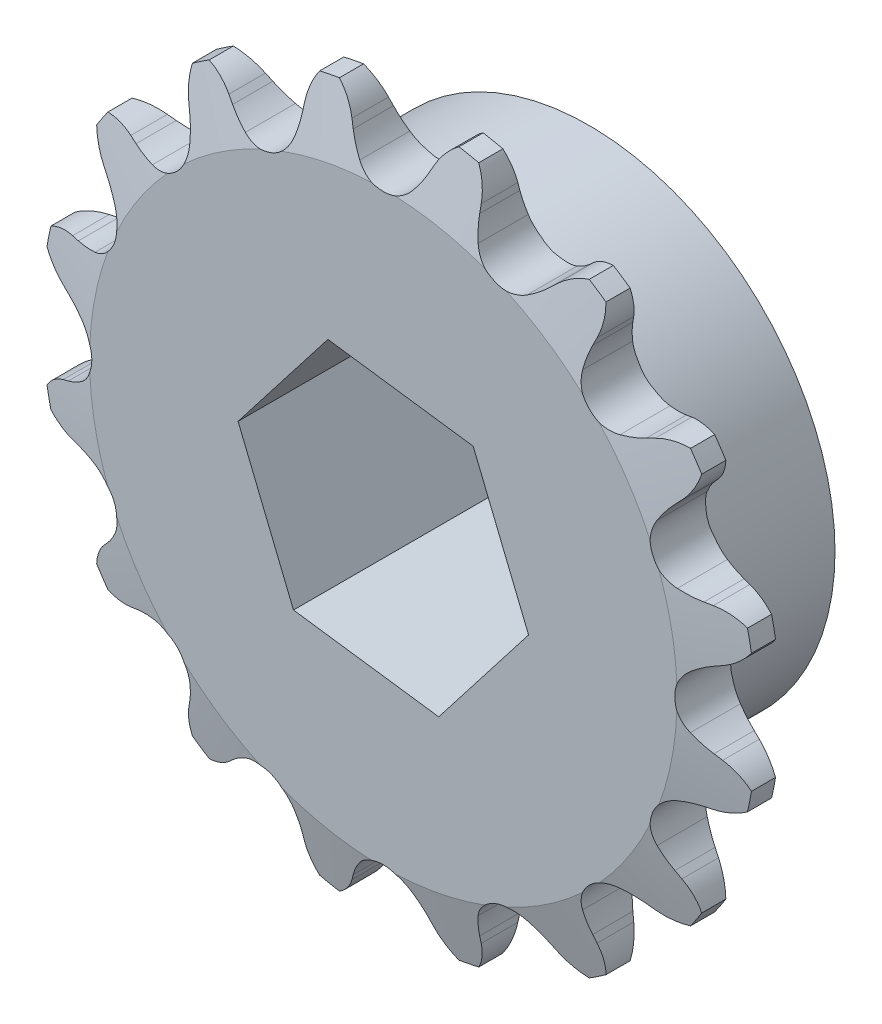
from build123d import *

# Parameters (mm, degrees)
TOOTH_CUT_NUMBER_OF_TEETH_16_DEPTH = 26.306064487
TOOTH_PATTERN_16_16_COUNT          = 16
SKETCH3_W                          = 7.493
SKETCH3_H                          = 12.303125
SKETCH4_R                          = 6.35
CUT_EXTRUDE1_DEPTH                 = 27.951719832
CUT_EXTRUDE4_DEPTH                 = 27.951719832


with BuildPart() as part:
    # Sprocket-BaseSketch → 25 (04C) ANSI (ISO) Chain Number, 1.281in P.D. (revolve)
    with BuildSketch(Plane(origin=(0, 0, 0), x_dir=(0, 0, -1), z_dir=(1, 0, 0))):
        Polygon((1.397, 0), (1.397, 14.691802887), (0.60325, 17.866802887), (-0.60325, 17.866802887), (-1.397, 14.691802887), (-1.397, 0), align=None)
    revolve(axis=Axis((0, 0, -5.588), (0, 0, 1)))

    # Tooth-Sketch → Tooth-Cut, Number of teeth: 16 (cut, symmetric)
    with BuildSketch(Plane.XY):
        with BuildLine():
            Line((1.895951627, 16.145861918), (2.051408678, 16.490963774))
            ThreePointArc((2.051408678, 16.490963774), (3.056004647, 17.659429879), (4.533974194, 18.095471295))
            ThreePointArc((4.533974194, 18.095471295), (0, 18.654838605), (-4.533974194, 18.095471295))
            ThreePointArc((-4.533974194, 18.095471295), (-3.056004647, 17.659429879), (-2.051408678, 16.490963774))
            Line((-2.051408678, 16.490963774), (-1.895951627, 16.145861918))
            ThreePointArc((-1.895951627, 16.145861918), (-1.639424454, 15.660854777), (-1.323740827, 15.212098758))
            ThreePointArc((-1.323740827, 15.212098758), (0, 14.577158093), (1.323740827, 15.212098758))
            ThreePointArc((1.323740827, 15.212098758), (1.639424454, 15.660854777), (1.895951627, 16.145861918))
        make_face()
    tooth_cut_number_of_teeth_16 = extrude(amount=TOOTH_CUT_NUMBER_OF_TEETH_16_DEPTH, both=True, mode=Mode.SUBTRACT)

    # Tooth Pattern, 16 / 16: Tooth-Cut, Number of teeth: 16 ×16 about axis
    tooth_pattern_16_16_axis = Axis((0, 0, -88.99), (0, 0, 1))
    for i in range(1, TOOTH_PATTERN_16_16_COUNT):
        add(tooth_cut_number_of_teeth_16.rotate(tooth_pattern_16_16_axis, i * 360 / TOOTH_PATTERN_16_16_COUNT), mode=Mode.SUBTRACT)

    # Sketch3 → Hub-Revolve1 (revolve)
    with BuildSketch(Plane(origin=(0, 0, 0), x_dir=(0, 0, -1), z_dir=(1, 0, 0))):
        with Locations((5.1435, 6.1515625)):
            Rectangle(SKETCH3_W, SKETCH3_H)
    revolve(axis=Axis((0, 0, 9.906), (0, 0, -1)))

    # Sketch4 → Cut-Extrude1 (cut, through all)
    with BuildSketch(Plane(origin=(0, 0, -8.89), x_dir=(-1, 0, 0), z_dir=(0, 0, -1))):
        Circle(SKETCH4_R)
    extrude(amount=-CUT_EXTRUDE1_DEPTH, mode=Mode.SUBTRACT)

    # Sketch11 → Cut-Extrude4 (cut, through all)
    with BuildSketch(Plane(origin=(0, 0, -8.89), x_dir=(-1, 0, 0), z_dir=(0, 0, -1))):
        Polygon((-2.771118031, -6.788537264), (4.49348671, -5.794127244), (7.264604741, 0.99441002), (2.771118031, 6.788537264), (-4.49348671, 5.794127244), (-7.264604741, -0.99441002), align=None)
    extrude(amount=-CUT_EXTRUDE4_DEPTH, mode=Mode.SUBTRACT)


solid = part.part
